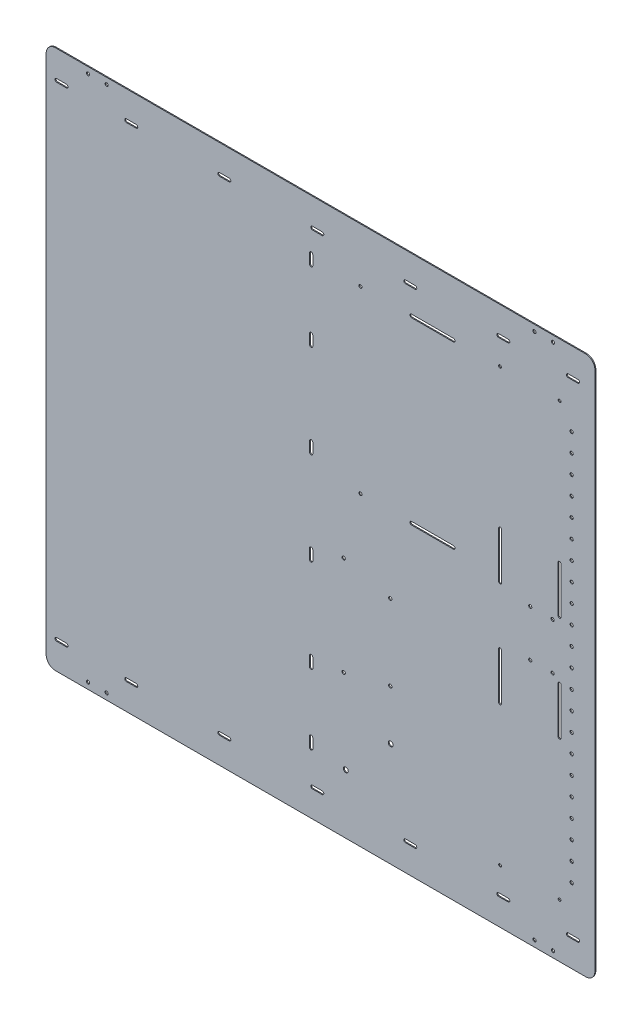
from build123d import *

# Parameters (mm, degrees)
SKETCH1_W            = 590
SKETCH1_H            = 580
BOSS_EXTRUDE1_DEPTH  = 1
FILLET1_R            = 10
SKETCH18_OUTSIDE_W   = 757.47
SKETCH18_OUTSIDE_H   = 747.47
SKETCH18_OUTSIDE_R   = 2.65
SKETCH18_OUTSIDE_R_2 = 1.75
SKETCH18_OUTSIDE_R_3 = 1.7
SKETCH18_OUTSIDE_R_4 = 1.5
SKETCH18_OUTSIDE_R_5 = 1.8
SKETCH18_OUTSIDE_R_6 = 1.725
CUT_EXTRUDE5_DEPTH   = 414.673784521


with BuildPart() as part:
    # Sketch1 → Boss-Extrude1 (new body)
    with BuildSketch(Plane.XY):
        Rectangle(SKETCH1_W, SKETCH1_H)
    extrude(amount=BOSS_EXTRUDE1_DEPTH)

    # Fillet1
    fillet1_edges = [part.edges().sort_by_distance(p)[0] for p in [
        (295, -290, 0.5),
        (-295, -290, 0.5),
        (-295, 290, 0.5),
        (295, 290, 0.5),
    ]]
    fillet(fillet1_edges, radius=FILLET1_R)

    # Sketch18 outside → Cut-Extrude5 (cut, through all)
    # profile 1 of 73: a face of its own
    with BuildSketch(Plane.XY):
        Rectangle(SKETCH18_OUTSIDE_W, SKETCH18_OUTSIDE_H)
        with BuildLine():
            Line((295, -280), (295, 280))
            ThreePointArc((295, 280), (292.071067812, 287.071067812), (285, 290))
            Line((285, 290), (-285, 290))
            ThreePointArc((-285, 290), (-292.071067812, 287.071067812), (-295, 280))
            Line((-295, 280), (-295, -280))
            ThreePointArc((-295, -280), (-292.071067812, -287.071067812), (-285, -290))
            Line((-285, -290), (285, -290))
            ThreePointArc((285, -290), (292.071067812, -287.071067812), (295, -280))
        make_face(mode=Mode.SUBTRACT)
    # profile 2 of 73: a face of its own
    with BuildSketch(Plane.XY):
        with Locations((75.5, -177.94482912)):
            Circle(SKETCH18_OUTSIDE_R)
    # profile 3 of 73: a face of its own
    with BuildSketch(Plane.XY):
        with Locations((27.186222069, -226.258607052)):
            Circle(SKETCH18_OUTSIDE_R)
    # profile 4 of 73: a face of its own
    with BuildSketch(Plane.XY):
        with Locations((270, -210)):
            Circle(SKETCH18_OUTSIDE_R_2)
    # profile 5 of 73: a face of its own
    with BuildSketch(Plane.XY):
        with Locations((270, -190)):
            Circle(SKETCH18_OUTSIDE_R_2)
    # profile 6 of 73: a face of its own
    with BuildSketch(Plane.XY):
        with Locations((270, -170)):
            Circle(SKETCH18_OUTSIDE_R_2)
    # profile 7 of 73: a face of its own
    with BuildSketch(Plane.XY):
        with Locations((270, -150)):
            Circle(SKETCH18_OUTSIDE_R_2)
    # profile 8 of 73: a face of its own
    with BuildSketch(Plane.XY):
        with Locations((270, -130)):
            Circle(SKETCH18_OUTSIDE_R_2)
    # profile 9 of 73: a face of its own
    with BuildSketch(Plane.XY):
        with Locations((270, -110)):
            Circle(SKETCH18_OUTSIDE_R_2)
    # profile 10 of 73: a face of its own
    with BuildSketch(Plane.XY):
        with Locations((270, -90)):
            Circle(SKETCH18_OUTSIDE_R_2)
    # profile 11 of 73: a face of its own
    with BuildSketch(Plane.XY):
        with Locations((270, -70)):
            Circle(SKETCH18_OUTSIDE_R_2)
    # profile 12 of 73: a face of its own
    with BuildSketch(Plane.XY):
        with Locations((270, -50)):
            Circle(SKETCH18_OUTSIDE_R_2)
    # profile 13 of 73: a face of its own
    with BuildSketch(Plane.XY):
        with Locations((270, -30)):
            Circle(SKETCH18_OUTSIDE_R_2)
    # profile 14 of 73: a face of its own
    with BuildSketch(Plane.XY):
        with Locations((270, -10)):
            Circle(SKETCH18_OUTSIDE_R_2)
    # profile 15 of 73: a face of its own
    with BuildSketch(Plane.XY):
        with Locations((270, 10)):
            Circle(SKETCH18_OUTSIDE_R_2)
    # profile 16 of 73: a face of its own
    with BuildSketch(Plane.XY):
        with Locations((270, 30)):
            Circle(SKETCH18_OUTSIDE_R_2)
    # profile 17 of 73: a face of its own
    with BuildSketch(Plane.XY):
        with Locations((270, 50)):
            Circle(SKETCH18_OUTSIDE_R_2)
    # profile 18 of 73: a face of its own
    with BuildSketch(Plane.XY):
        with Locations((270, 70)):
            Circle(SKETCH18_OUTSIDE_R_2)
    # profile 19 of 73: a face of its own
    with BuildSketch(Plane.XY):
        with Locations((270, 90)):
            Circle(SKETCH18_OUTSIDE_R_2)
    # profile 20 of 73: a face of its own
    with BuildSketch(Plane.XY):
        with Locations((270, 110)):
            Circle(SKETCH18_OUTSIDE_R_2)
    # profile 21 of 73: a face of its own
    with BuildSketch(Plane.XY):
        with Locations((270, 130)):
            Circle(SKETCH18_OUTSIDE_R_2)
    # profile 22 of 73: a face of its own
    with BuildSketch(Plane.XY):
        with Locations((270, 150)):
            Circle(SKETCH18_OUTSIDE_R_2)
    # profile 23 of 73: a face of its own
    with BuildSketch(Plane.XY):
        with Locations((270, 170)):
            Circle(SKETCH18_OUTSIDE_R_2)
    # profile 24 of 73: a face of its own
    with BuildSketch(Plane.XY):
        with Locations((270, 190)):
            Circle(SKETCH18_OUTSIDE_R_2)
    # profile 25 of 73: a face of its own
    with BuildSketch(Plane.XY):
        with Locations((270, 210)):
            Circle(SKETCH18_OUTSIDE_R_2)
    # profile 26 of 73: a face of its own
    with BuildSketch(Plane.XY):
        with Locations((42.9, 231.74)):
            Circle(SKETCH18_OUTSIDE_R_3)
    # profile 27 of 73: a face of its own
    with BuildSketch(Plane.XY):
        with Locations((42.9, 38.74)):
            Circle(SKETCH18_OUTSIDE_R_3)
    # profile 28 of 73: a face of its own
    with BuildSketch(Plane.XY):
        with Locations((193, 232.26)):
            Circle(SKETCH18_OUTSIDE_R_4)
    # profile 29 of 73: a face of its own
    with BuildSketch(Plane.XY):
        with Locations((193, -232.26)):
            Circle(SKETCH18_OUTSIDE_R_4)
    # profile 30 of 73: a face of its own
    with BuildSketch(Plane.XY):
        with Locations((257, -232.26)):
            Circle(SKETCH18_OUTSIDE_R_4)
    # profile 31 of 73: a face of its own
    with BuildSketch(Plane.XY):
        with Locations((257, 232.26)):
            Circle(SKETCH18_OUTSIDE_R_4)
    # profile 32 of 73: a face of its own
    with BuildSketch(Plane.XY):
        with Locations((225.5, -25)):
            Circle(SKETCH18_OUTSIDE_R_3)
    # profile 33 of 73: a face of its own
    with BuildSketch(Plane.XY):
        with Locations((249.5, 25)):
            Circle(SKETCH18_OUTSIDE_R_3)
    # profile 34 of 73: a face of its own
    with BuildSketch(Plane.XY):
        with Locations((225.5, 25)):
            Circle(SKETCH18_OUTSIDE_R_3)
    # profile 35 of 73: a face of its own
    with BuildSketch(Plane.XY):
        with Locations((249.5, -25)):
            Circle(SKETCH18_OUTSIDE_R_3)
    # profile 36 of 73: a face of its own
    with BuildSketch(Plane.XY):
        with Locations((24.9, -136.76)):
            Circle(SKETCH18_OUTSIDE_R_5)
    # profile 37 of 73: a face of its own
    with BuildSketch(Plane.XY):
        with Locations((24.9, -30.26)):
            Circle(SKETCH18_OUTSIDE_R_5)
    # profile 38 of 73: a face of its own
    with BuildSketch(Plane.XY):
        with Locations((75, -42.76)):
            Circle(SKETCH18_OUTSIDE_R_5)
    # profile 39 of 73: a face of its own
    with BuildSketch(Plane.XY):
        with Locations((75, -124.26)):
            Circle(SKETCH18_OUTSIDE_R_5)
    # profile 40 of 73: a face of its own
    with BuildSketch(Plane.XY):
        with Locations((-250, -283.26)):
            Circle(SKETCH18_OUTSIDE_R_6)
    # profile 41 of 73: a face of its own
    with BuildSketch(Plane.XY):
        with Locations((250, 283.26)):
            Circle(SKETCH18_OUTSIDE_R_6)
    # profile 42 of 73: a face of its own
    with BuildSketch(Plane.XY):
        with Locations((-250, 283.26)):
            Circle(SKETCH18_OUTSIDE_R_6)
    # profile 43 of 73: a face of its own
    with BuildSketch(Plane.XY):
        with Locations((230, 283.26)):
            Circle(SKETCH18_OUTSIDE_R_6)
    # profile 44 of 73: a face of its own
    with BuildSketch(Plane.XY):
        with Locations((230, -283.26)):
            Circle(SKETCH18_OUTSIDE_R_6)
    # profile 45 of 73: a face of its own
    with BuildSketch(Plane.XY):
        with Locations((-230, -283.26)):
            Circle(SKETCH18_OUTSIDE_R_6)
    # profile 46 of 73: a face of its own
    with BuildSketch(Plane.XY):
        with Locations((-230, 283.26)):
            Circle(SKETCH18_OUTSIDE_R_6)
    # profile 47 of 73: a face of its own
    with BuildSketch(Plane.XY):
        with Locations((250, -283.26)):
            Circle(SKETCH18_OUTSIDE_R_6)
    # profile 48 of 73: a face of its own
    with BuildSketch(Plane.XY):
        with BuildLine():
            Line((142.9, 37.04), (97.9, 37.04))
            ThreePointArc((97.9, 37.04), (96.2, 38.74), (97.9, 40.44))
            Line((97.9, 40.44), (142.9, 40.44))
            ThreePointArc((142.9, 40.44), (144.6, 38.74), (142.9, 37.04))
        make_face()
    # profile 49 of 73: a face of its own
    with BuildSketch(Plane.XY):
        with BuildLine():
            Line((142.9, 230.04), (97.9, 230.04))
            ThreePointArc((97.9, 230.04), (96.2, 231.74), (97.9, 233.44))
            Line((97.9, 233.44), (142.9, 233.44))
            ThreePointArc((142.9, 233.44), (144.6, 231.74), (142.9, 230.04))
        make_face()
    # profile 50 of 73: a face of its own
    with BuildSketch(Plane.XY):
        with BuildLine():
            Line((255.5, 31.26), (255.5, 81.26))
            ThreePointArc((255.5, 81.26), (257, 82.76), (258.5, 81.26))
            Line((258.5, 81.26), (258.5, 31.26))
            ThreePointArc((258.5, 31.26), (257, 29.76), (255.5, 31.26))
        make_face()
    # profile 51 of 73: a face of its own
    with BuildSketch(Plane.XY):
        with BuildLine():
            Line((191.5, 31.26), (191.5, 81.26))
            ThreePointArc((191.5, 81.26), (193, 82.76), (194.5, 81.26))
            Line((194.5, 81.26), (194.5, 31.26))
            ThreePointArc((194.5, 31.26), (193, 29.76), (191.5, 31.26))
        make_face()
    # profile 52 of 73: a face of its own
    with BuildSketch(Plane.XY):
        with BuildLine():
            Line((194.5, -31.26), (194.5, -81.26))
            ThreePointArc((194.5, -81.26), (193, -82.76), (191.5, -81.26))
            Line((191.5, -81.26), (191.5, -31.26))
            ThreePointArc((191.5, -31.26), (193, -29.76), (194.5, -31.26))
        make_face()
    # profile 53 of 73: a face of its own
    with BuildSketch(Plane.XY):
        with BuildLine():
            Line((258.5, -31.26), (258.5, -81.26))
            ThreePointArc((258.5, -81.26), (257, -82.76), (255.5, -81.26))
            Line((255.5, -81.26), (255.5, -31.26))
            ThreePointArc((255.5, -31.26), (257, -29.76), (258.5, -31.26))
        make_face()
    # profile 54 of 73: a face of its own
    with BuildSketch(Plane.XY):
        with BuildLine():
            Line((-198.25, -258.51), (-208.75, -258.51))
            ThreePointArc((-208.75, -258.51), (-210.5, -260.26), (-208.75, -262.01))
            Line((-208.75, -262.01), (-198.25, -262.01))
            ThreePointArc((-198.25, -262.01), (-196.5, -260.26), (-198.25, -258.51))
        make_face()
    # profile 55 of 73: a face of its own
    with BuildSketch(Plane.XY):
        with BuildLine():
            Line((-273.25, 262.01), (-283.75, 262.01))
            ThreePointArc((-283.75, 262.01), (-285.5, 260.26), (-283.75, 258.51))
            Line((-283.75, 258.51), (-273.25, 258.51))
            ThreePointArc((-273.25, 258.51), (-271.5, 260.26), (-273.25, 262.01))
        make_face()
    # profile 56 of 73: a face of its own
    with BuildSketch(Plane.XY):
        with BuildLine():
            Line((276.75, 262.01), (266.25, 262.01))
            ThreePointArc((266.25, 262.01), (264.5, 260.26), (266.25, 258.51))
            Line((266.25, 258.51), (276.75, 258.51))
            ThreePointArc((276.75, 258.51), (278.5, 260.26), (276.75, 262.01))
        make_face()
    # profile 57 of 73: a face of its own
    with BuildSketch(Plane.XY):
        with BuildLine():
            Line((276.75, -258.51), (266.25, -258.51))
            ThreePointArc((266.25, -258.51), (264.5, -260.26), (266.25, -262.01))
            Line((266.25, -262.01), (276.75, -262.01))
            ThreePointArc((276.75, -262.01), (278.5, -260.26), (276.75, -258.51))
        make_face()
    # profile 58 of 73: a face of its own
    with BuildSketch(Plane.XY):
        with BuildLine():
            Line((-8.35, -49.7), (-8.35, -39.2))
            ThreePointArc((-8.35, -39.2), (-10.1, -37.45), (-11.85, -39.2))
            Line((-11.85, -39.2), (-11.85, -49.7))
            ThreePointArc((-11.85, -49.7), (-10.1, -51.45), (-8.35, -49.7))
        make_face()
    # profile 59 of 73: a face of its own
    with BuildSketch(Plane.XY):
        with BuildLine():
            Line((-8.35, 50.3), (-8.35, 60.8))
            ThreePointArc((-8.35, 60.8), (-10.1, 62.55), (-11.85, 60.8))
            Line((-11.85, 60.8), (-11.85, 50.3))
            ThreePointArc((-11.85, 50.3), (-10.1, 48.55), (-8.35, 50.3))
        make_face()
    # profile 60 of 73: a face of its own
    with BuildSketch(Plane.XY):
        with BuildLine():
            Line((-8.35, 150.3), (-8.35, 160.8))
            ThreePointArc((-8.35, 160.8), (-10.1, 162.55), (-11.85, 160.8))
            Line((-11.85, 160.8), (-11.85, 150.3))
            ThreePointArc((-11.85, 150.3), (-10.1, 148.55), (-8.35, 150.3))
        make_face()
    # profile 61 of 73: a face of its own
    with BuildSketch(Plane.XY):
        with BuildLine():
            Line((-273.25, -258.51), (-283.75, -258.51))
            ThreePointArc((-283.75, -258.51), (-285.5, -260.26), (-283.75, -262.01))
            Line((-283.75, -262.01), (-273.25, -262.01))
            ThreePointArc((-273.25, -262.01), (-271.5, -260.26), (-273.25, -258.51))
        make_face()
    # profile 62 of 73: a face of its own
    with BuildSketch(Plane.XY):
        with BuildLine():
            Line((201.75, -258.51), (191.25, -258.51))
            ThreePointArc((191.25, -258.51), (189.5, -260.26), (191.25, -262.01))
            Line((191.25, -262.01), (201.75, -262.01))
            ThreePointArc((201.75, -262.01), (203.5, -260.26), (201.75, -258.51))
        make_face()
    # profile 63 of 73: a face of its own
    with BuildSketch(Plane.XY):
        with BuildLine():
            Line((101.75, -258.51), (91.25, -258.51))
            ThreePointArc((91.25, -258.51), (89.5, -260.26), (91.25, -262.01))
            Line((91.25, -262.01), (101.75, -262.01))
            ThreePointArc((101.75, -262.01), (103.5, -260.26), (101.75, -258.51))
        make_face()
    # profile 64 of 73: a face of its own
    with BuildSketch(Plane.XY):
        with BuildLine():
            Line((1.75, -258.51), (-8.75, -258.51))
            ThreePointArc((-8.75, -258.51), (-10.5, -260.26), (-8.75, -262.01))
            Line((-8.75, -262.01), (1.75, -262.01))
            ThreePointArc((1.75, -262.01), (3.5, -260.26), (1.75, -258.51))
        make_face()
    # profile 65 of 73: a face of its own
    with BuildSketch(Plane.XY):
        with BuildLine():
            Line((-98.25, -258.51), (-108.75, -258.51))
            ThreePointArc((-108.75, -258.51), (-110.5, -260.26), (-108.75, -262.01))
            Line((-108.75, -262.01), (-98.25, -262.01))
            ThreePointArc((-98.25, -262.01), (-96.5, -260.26), (-98.25, -258.51))
        make_face()
    # profile 66 of 73: a face of its own
    with BuildSketch(Plane.XY):
        with BuildLine():
            Line((201.75, 262.01), (191.25, 262.01))
            ThreePointArc((191.25, 262.01), (189.5, 260.26), (191.25, 258.51))
            Line((191.25, 258.51), (201.75, 258.51))
            ThreePointArc((201.75, 258.51), (203.5, 260.26), (201.75, 262.01))
        make_face()
    # profile 67 of 73: a face of its own
    with BuildSketch(Plane.XY):
        with BuildLine():
            Line((101.75, 262.01), (91.25, 262.01))
            ThreePointArc((91.25, 262.01), (89.5, 260.26), (91.25, 258.51))
            Line((91.25, 258.51), (101.75, 258.51))
            ThreePointArc((101.75, 258.51), (103.5, 260.26), (101.75, 262.01))
        make_face()
    # profile 68 of 73: a face of its own
    with BuildSketch(Plane.XY):
        with BuildLine():
            Line((1.75, 262.01), (-8.75, 262.01))
            ThreePointArc((-8.75, 262.01), (-10.5, 260.26), (-8.75, 258.51))
            Line((-8.75, 258.51), (1.75, 258.51))
            ThreePointArc((1.75, 258.51), (3.5, 260.26), (1.75, 262.01))
        make_face()
    # profile 69 of 73: a face of its own
    with BuildSketch(Plane.XY):
        with BuildLine():
            Line((-98.25, 262.01), (-108.75, 262.01))
            ThreePointArc((-108.75, 262.01), (-110.5, 260.26), (-108.75, 258.51))
            Line((-108.75, 258.51), (-98.25, 258.51))
            ThreePointArc((-98.25, 258.51), (-96.5, 260.26), (-98.25, 262.01))
        make_face()
    # profile 70 of 73: a face of its own
    with BuildSketch(Plane.XY):
        with BuildLine():
            Line((-8.35, -149.7), (-8.35, -139.2))
            ThreePointArc((-8.35, -139.2), (-10.1, -137.45), (-11.85, -139.2))
            Line((-11.85, -139.2), (-11.85, -149.7))
            ThreePointArc((-11.85, -149.7), (-10.1, -151.45), (-8.35, -149.7))
        make_face()
    # profile 71 of 73: a face of its own
    with BuildSketch(Plane.XY):
        with BuildLine():
            Line((-8.35, 225.3), (-8.35, 235.8))
            ThreePointArc((-8.35, 235.8), (-10.1, 237.55), (-11.85, 235.8))
            Line((-11.85, 235.8), (-11.85, 225.3))
            ThreePointArc((-11.85, 225.3), (-10.1, 223.55), (-8.35, 225.3))
        make_face()
    # profile 72 of 73: a face of its own
    with BuildSketch(Plane.XY):
        with BuildLine():
            Line((-8.35, -224.7), (-8.35, -214.2))
            ThreePointArc((-8.35, -214.2), (-10.1, -212.45), (-11.85, -214.2))
            Line((-11.85, -214.2), (-11.85, -224.7))
            ThreePointArc((-11.85, -224.7), (-10.1, -226.45), (-8.35, -224.7))
        make_face()
    # profile 73 of 73: a face of its own
    with BuildSketch(Plane.XY):
        with BuildLine():
            Line((-198.25, 262.01), (-208.75, 262.01))
            ThreePointArc((-208.75, 262.01), (-210.5, 260.26), (-208.75, 258.51))
            Line((-208.75, 258.51), (-198.25, 258.51))
            ThreePointArc((-198.25, 258.51), (-196.5, 260.26), (-198.25, 262.01))
        make_face()
    extrude(amount=CUT_EXTRUDE5_DEPTH, mode=Mode.SUBTRACT)


solid = part.part
